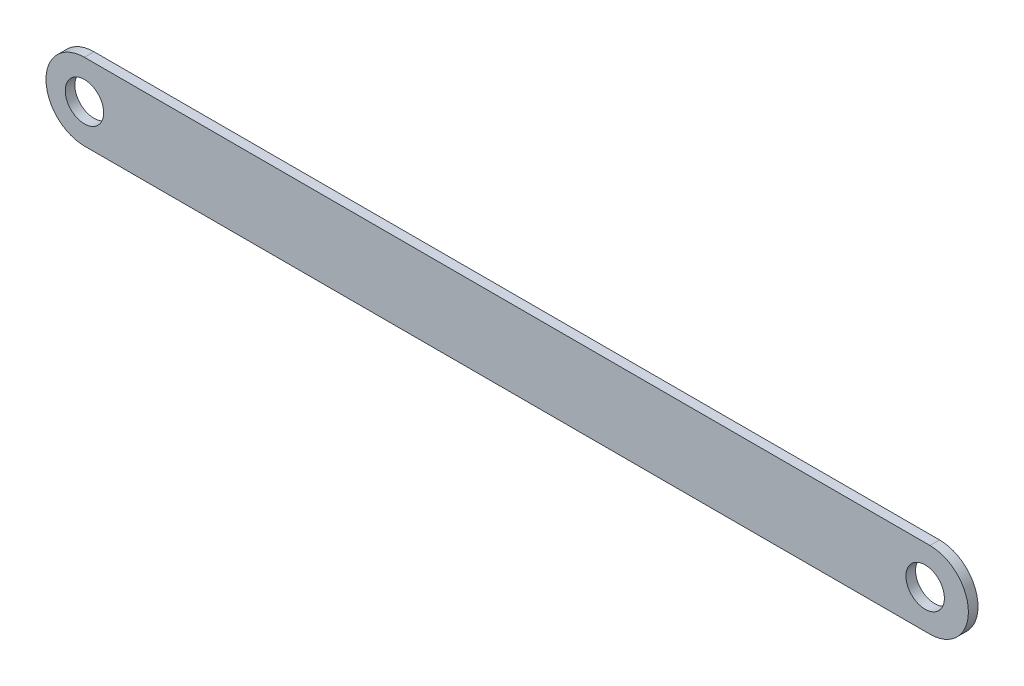
from build123d import *

# Parameters (mm, degrees)
BOSS_EXTRUDE1_DEPTH = 3.175
SKETCH2_R           = 12.7
CUT_EXTRUDE1_DEPTH  = 585.786390488


with BuildPart() as part:
    # Sketch1 → Boss-Extrude1 (new, symmetric)
    with BuildSketch(Plane.XY):
        with BuildLine():
            Line((0, 25.4), (558.8, 25.4))
            ThreePointArc((558.8, 25.4), (584.2, 0), (558.8, -25.4))
            Line((558.8, -25.4), (0, -25.4))
            ThreePointArc((0, -25.4), (-25.4, 0), (0, 25.4))
        make_face()
    extrude(amount=BOSS_EXTRUDE1_DEPTH, both=True)

    # Sketch2 → Cut-Extrude1 (cut, through all)
    with BuildSketch(Plane.XY.offset(3.175)):
        with Locations((555.625, 0)):
            Circle(SKETCH2_R)
        Circle(SKETCH2_R)
    extrude(amount=-CUT_EXTRUDE1_DEPTH, mode=Mode.SUBTRACT)


solid = part.part
